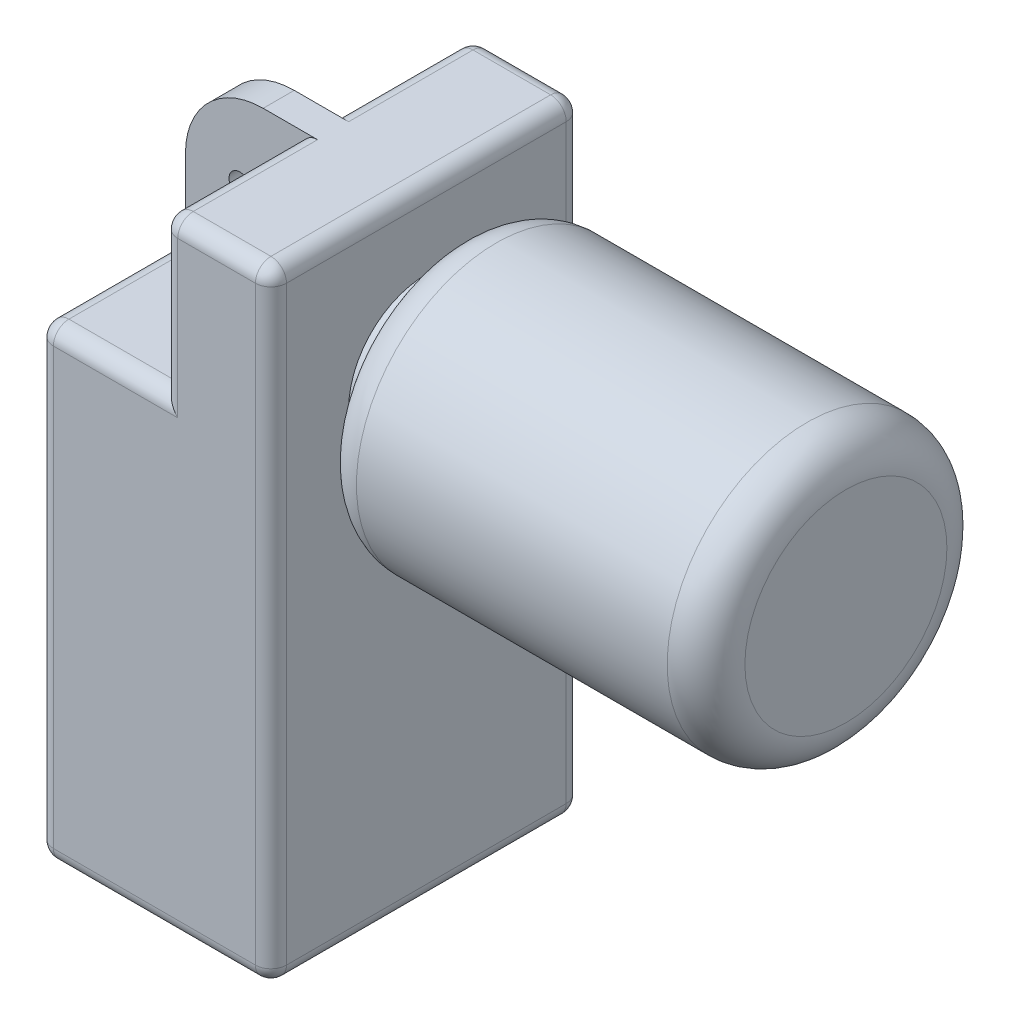
from build123d import *

# Parameters (mm, degrees)
SKETCH_1_R          = 7
EXTRUDE_1_DEPTH     = 20
SKETCH_2_W          = 150
SKETCH_2_H          = 200
EXTRUDE_2_DEPTH     = 300
SKETCH_3_W          = 70
SKETCH_3_H          = 200
EXTRUDE_3_DEPTH     = 100
SKETCH_4_R          = 50
EXTRUDE_4_DEPTH     = 20
SKETCH_5_R          = 90
EXTRUDE_5_DEPTH     = 250
FILLET_1_R          = 25
FILLET_2_R          = 10
SKETCH_6_R          = 25.5
CUT_EXTRUDE_1_DEPTH = 100


with BuildPart() as part:
    # 草图1 → 凸台-拉伸1 (new body)
    with BuildSketch(Plane.XY):
        with BuildLine():
            Line((-35, 0), (-35, -50))
            Line((-35, -50), (40, -50))
            Line((40, -50), (40, 50))
            Line((40, 50), (15, 50))
            ThreePointArc((15, 50), (-20.355339059, 35.355339059), (-35, 0))
        make_face()
        Circle(SKETCH_1_R, mode=Mode.SUBTRACT)
    extrude(amount=EXTRUDE_1_DEPTH)

    # 草图2 → 凸台-拉伸2 (add)
    with BuildSketch(Plane(origin=(0, -50, 0), x_dir=(-1, 0, 0), z_dir=(0, -1, 0))):
        with Locations((-35, -10)):
            Rectangle(SKETCH_2_W, SKETCH_2_H)
    extrude(amount=EXTRUDE_2_DEPTH)

    # 草图3 → 凸台-拉伸3 (add)
    with BuildSketch(Plane(origin=(0, -50, 0), x_dir=(1, 0, 0), z_dir=(0, 1, 0))):
        with Locations((75, -10)):
            Rectangle(SKETCH_3_W, SKETCH_3_H)
    extrude(amount=EXTRUDE_3_DEPTH)

    # 草图4 → 凸台-拉伸4 (add)
    with BuildSketch(Plane(origin=(110, 0, 0), x_dir=(0, 0, -1), z_dir=(1, 0, 0))):
        with Locations(Location((-10, -50, 0), (0, 0, 180))):
            Circle(SKETCH_4_R)
    extrude(amount=EXTRUDE_4_DEPTH)

    # 草图5 → 凸台-拉伸5 (add)
    with BuildSketch(Plane(origin=(130, 0, 0), x_dir=(0, 0, -1), z_dir=(1, 0, 0))):
        with Locations((-10, -50)):
            Circle(SKETCH_5_R)
    extrude(amount=EXTRUDE_5_DEPTH)

    # 圆角1
    fillet_1_edges = [part.edges().sort_by_distance(p)[0] for p in [
        (130, -50, 100),
        (380, -50, 100),
    ]]
    fillet(fillet_1_edges, radius=FILLET_1_R)

    # 圆角2
    # the kernel refuses this fillet: 10 mm, written as the material it takes off along each edge
    with BuildSketch(Plane(origin=(50, 40, 100), x_dir=(-1, 0, 0), z_dir=(0, 1, 0))) as fillet_2_piece_1_section:
        Polygon((0, 0), (FILLET_2_R, 0), (FILLET_2_R, FILLET_2_R), (0, FILLET_2_R), align=None)
    fillet_2_piece_1 = extrude(amount=FILLET_2_R, mode=Mode.PRIVATE)
    fillet_2_piece_1 = fillet_2_piece_1 - Plane(origin=(50, 40, 100), x_dir=(0.7071067811865475, 0, -0.7071067811865477), z_dir=(0, 1, 0)) * Sphere(FILLET_2_R, mode=Mode.PRIVATE)
    add(fillet_2_piece_1, mode=Mode.SUBTRACT)
    with BuildSketch(Plane(origin=(100, 40, 100), x_dir=(1, 0, 0), z_dir=(0, 1, 0))) as fillet_2_piece_2_section:
        Polygon((0, 0), (FILLET_2_R, 0), (FILLET_2_R, -FILLET_2_R), (0, -FILLET_2_R), align=None)
    fillet_2_piece_2 = extrude(amount=FILLET_2_R, mode=Mode.PRIVATE)
    fillet_2_piece_2 = fillet_2_piece_2 - Plane(origin=(100, 40, 100), x_dir=(-0.7071067811865475, 0, -0.7071067811865476), z_dir=(0, 1, 0)) * Sphere(FILLET_2_R, mode=Mode.PRIVATE)
    add(fillet_2_piece_2, mode=Mode.SUBTRACT)
    with BuildSketch(Plane(origin=(-30, -60, -80), x_dir=(-1, 0, 0), z_dir=(0, 0, -1))) as fillet_2_piece_3_section:
        Polygon((0, 0), (FILLET_2_R, 0), (FILLET_2_R, FILLET_2_R), (0, FILLET_2_R), align=None)
    fillet_2_piece_3 = extrude(amount=FILLET_2_R, mode=Mode.PRIVATE)
    fillet_2_piece_3 = fillet_2_piece_3 - Plane(origin=(-30, -60, -80), x_dir=(0.7071067811865475, -0.7071067811865475, 0), z_dir=(0, 0, -1)) * Sphere(FILLET_2_R, mode=Mode.PRIVATE)
    add(fillet_2_piece_3, mode=Mode.SUBTRACT)
    with BuildSketch(Plane(origin=(-30, -60, 100), x_dir=(0, 1, 0), z_dir=(-1, 0, 0))) as fillet_2_piece_4_section:
        Polygon((0, 0), (FILLET_2_R, 0), (FILLET_2_R, -FILLET_2_R), (0, -FILLET_2_R), align=None)
    fillet_2_piece_4 = extrude(amount=FILLET_2_R, mode=Mode.PRIVATE)
    fillet_2_piece_4 = fillet_2_piece_4 - Plane(origin=(-30, -60, 100), x_dir=(0, -0.7071067811865475, -0.7071067811865475), z_dir=(-1, 0, 0)) * Sphere(FILLET_2_R, mode=Mode.PRIVATE)
    add(fillet_2_piece_4, mode=Mode.SUBTRACT)
    with BuildSketch(Plane(origin=(-30, -340, 100), x_dir=(-1, 0, 0), z_dir=(0, -1, 0))) as fillet_2_piece_5_section:
        Polygon((0, 0), (FILLET_2_R, 0), (FILLET_2_R, -FILLET_2_R), (0, -FILLET_2_R), align=None)
    fillet_2_piece_5 = extrude(amount=FILLET_2_R, mode=Mode.PRIVATE)
    fillet_2_piece_5 = fillet_2_piece_5 - Plane(origin=(-30, -340, 100), x_dir=(0.7071067811865475, 0, -0.7071067811865475), z_dir=(0, -1, 0)) * Sphere(FILLET_2_R, mode=Mode.PRIVATE)
    add(fillet_2_piece_5, mode=Mode.SUBTRACT)
    with BuildSketch(Plane(origin=(100, -340, 100), x_dir=(1, 0, 0), z_dir=(0, -1, 0))) as fillet_2_piece_6_section:
        Polygon((0, 0), (FILLET_2_R, 0), (FILLET_2_R, FILLET_2_R), (0, FILLET_2_R), align=None)
    fillet_2_piece_6 = extrude(amount=FILLET_2_R, mode=Mode.PRIVATE)
    fillet_2_piece_6 = fillet_2_piece_6 - Plane(origin=(100, -340, 100), x_dir=(-0.7071067811865475, 0, -0.7071067811865476), z_dir=(0, -1, 0)) * Sphere(FILLET_2_R, mode=Mode.PRIVATE)
    add(fillet_2_piece_6, mode=Mode.SUBTRACT)
    with BuildSketch(Plane(origin=(100, -340, -80), x_dir=(0, 0, -1), z_dir=(0, -1, 0))) as fillet_2_piece_7_section:
        Polygon((0, 0), (FILLET_2_R, 0), (FILLET_2_R, FILLET_2_R), (0, FILLET_2_R), align=None)
    fillet_2_piece_7 = extrude(amount=FILLET_2_R, mode=Mode.PRIVATE)
    fillet_2_piece_7 = fillet_2_piece_7 - Plane(origin=(100, -340, -80), x_dir=(-0.7071067811865475, 0, 0.7071067811865475), z_dir=(0, -1, 0)) * Sphere(FILLET_2_R, mode=Mode.PRIVATE)
    add(fillet_2_piece_7, mode=Mode.SUBTRACT)
    with BuildSketch(Plane(origin=(-30, -340, -80), x_dir=(0, 0, -1), z_dir=(0, -1, 0))) as fillet_2_piece_8_section:
        Polygon((0, 0), (FILLET_2_R, 0), (FILLET_2_R, -FILLET_2_R), (0, -FILLET_2_R), align=None)
    fillet_2_piece_8 = extrude(amount=FILLET_2_R, mode=Mode.PRIVATE)
    fillet_2_piece_8 = fillet_2_piece_8 - Plane(origin=(-30, -340, -80), x_dir=(0.7071067811865475, 0, 0.7071067811865476), z_dir=(0, -1, 0)) * Sphere(FILLET_2_R, mode=Mode.PRIVATE)
    add(fillet_2_piece_8, mode=Mode.SUBTRACT)
    with BuildSketch(Plane(origin=(50, 40, -80), x_dir=(0, 0, -1), z_dir=(0, 1, 0))) as fillet_2_piece_9_section:
        Polygon((0, 0), (FILLET_2_R, 0), (FILLET_2_R, FILLET_2_R), (0, FILLET_2_R), align=None)
    fillet_2_piece_9 = extrude(amount=FILLET_2_R, mode=Mode.PRIVATE)
    fillet_2_piece_9 = fillet_2_piece_9 - Plane(origin=(50, 40, -80), x_dir=(0.7071067811865475, 0, 0.7071067811865475), z_dir=(0, 1, 0)) * Sphere(FILLET_2_R, mode=Mode.PRIVATE)
    add(fillet_2_piece_9, mode=Mode.SUBTRACT)
    with BuildSketch(Plane(origin=(100, 40, -80), x_dir=(0, 0, -1), z_dir=(0, 1, 0))) as fillet_2_piece_10_section:
        Polygon((0, 0), (FILLET_2_R, 0), (FILLET_2_R, -FILLET_2_R), (0, -FILLET_2_R), align=None)
    fillet_2_piece_10 = extrude(amount=FILLET_2_R, mode=Mode.PRIVATE)
    fillet_2_piece_10 = fillet_2_piece_10 - Plane(origin=(100, 40, -80), x_dir=(-0.7071067811865475, 0, 0.7071067811865475), z_dir=(0, 1, 0)) * Sphere(FILLET_2_R, mode=Mode.PRIVATE)
    add(fillet_2_piece_10, mode=Mode.SUBTRACT)
    with BuildSketch(Plane(origin=(50, 50, 110), x_dir=(0, -1, 0), z_dir=(1, 0, 0))) as fillet_2_piece_11:
        with BuildLine():
            CenterArc((FILLET_2_R, FILLET_2_R), FILLET_2_R, 180, 90)
            Line((0, FILLET_2_R), (0, 0))
            Line((0, 0), (FILLET_2_R, 0))
        make_face()
    extrude(amount=50, mode=Mode.SUBTRACT)
    with BuildSketch(Plane(origin=(40, -50, 110), x_dir=(1, 0, 0), z_dir=(0, 1, 0))) as fillet_2_piece_12:
        with BuildLine():
            CenterArc((FILLET_2_R, FILLET_2_R), FILLET_2_R, 180, 90)
            Line((0, FILLET_2_R), (0, 0))
            Line((0, 0), (FILLET_2_R, 0))
        make_face()
    extrude(amount=90, mode=Mode.SUBTRACT)
    with BuildSketch(Plane(origin=(-40, -50, -80), x_dir=(0, -1, 0), z_dir=(0, 0, 1))) as fillet_2_piece_13_section:
        with BuildLine():
            CenterArc((FILLET_2_R, FILLET_2_R), FILLET_2_R, 180, 90)
            Line((0, FILLET_2_R), (0, 0))
            Line((0, 0), (FILLET_2_R, 0))
        make_face()
    fillet_2_piece_13 = extrude(amount=180, mode=Mode.PRIVATE)
    fillet_2_piece_13 = split(fillet_2_piece_13, bisect_by=Plane(origin=(-38.356082357, -52.5512006, 0), z_dir=(0, 0, -1)), keep=Keep.TOP, mode=Mode.PRIVATE)
    fillet_2_piece_13 = split(fillet_2_piece_13, bisect_by=Plane(origin=(-35, -52.5512006, -40), z_dir=(-1, 0, 0)), keep=Keep.TOP, mode=Mode.PRIVATE)
    add(fillet_2_piece_13, mode=Mode.SUBTRACT)
    with BuildSketch(Plane(origin=(-40, -50, -80), x_dir=(0, -1, 0), z_dir=(0, 0, 1))) as fillet_2_piece_14_section:
        with BuildLine():
            CenterArc((FILLET_2_R, FILLET_2_R), FILLET_2_R, 180, 90)
            Line((0, FILLET_2_R), (0, 0))
            Line((0, 0), (FILLET_2_R, 0))
        make_face()
    fillet_2_piece_14 = extrude(amount=180, mode=Mode.PRIVATE)
    fillet_2_piece_14 = split(fillet_2_piece_14, bisect_by=Plane(origin=(-33.367492155, -50.240083817, 0), z_dir=(0, 0, -1)), keep=Keep.TOP, mode=Mode.PRIVATE)
    fillet_2_piece_14 = split(fillet_2_piece_14, bisect_by=Plane(origin=(-35, -50.240083817, -40), z_dir=(1, 0, 0)), keep=Keep.TOP, mode=Mode.PRIVATE)
    add(fillet_2_piece_14, mode=Mode.SUBTRACT)
    with BuildSketch(Plane(origin=(-40, -50, -80), x_dir=(0, -1, 0), z_dir=(0, 0, 1))) as fillet_2_piece_15_section:
        with BuildLine():
            CenterArc((FILLET_2_R, FILLET_2_R), FILLET_2_R, 180, 90)
            Line((0, FILLET_2_R), (0, 0))
            Line((0, 0), (FILLET_2_R, 0))
        make_face()
    fillet_2_piece_15 = extrude(amount=180, mode=Mode.PRIVATE)
    fillet_2_piece_15 = split(fillet_2_piece_15, bisect_by=Plane(origin=(-38.356082357, -52.5512006, 0), z_dir=(0, 0, 1)), keep=Keep.TOP, mode=Mode.PRIVATE)
    fillet_2_piece_15 = split(fillet_2_piece_15, bisect_by=Plane(origin=(-35, -52.5512006, 10), z_dir=(-1, 0, 0)), keep=Keep.TOP, mode=Mode.PRIVATE)
    fillet_2_piece_15 = split(fillet_2_piece_15, bisect_by=Plane(origin=(-38.356082357, -52.5512006, 20), z_dir=(0, 0, -1)), keep=Keep.TOP, mode=Mode.PRIVATE)
    add(fillet_2_piece_15, mode=Mode.SUBTRACT)
    with BuildSketch(Plane(origin=(-40, -50, -80), x_dir=(0, -1, 0), z_dir=(0, 0, 1))) as fillet_2_piece_16_section:
        with BuildLine():
            CenterArc((FILLET_2_R, FILLET_2_R), FILLET_2_R, 180, 90)
            Line((0, FILLET_2_R), (0, 0))
            Line((0, 0), (FILLET_2_R, 0))
        make_face()
    fillet_2_piece_16 = extrude(amount=180, mode=Mode.PRIVATE)
    fillet_2_piece_16 = split(fillet_2_piece_16, bisect_by=Plane(origin=(-35, -52.5512006, 60), z_dir=(-1, 0, 0)), keep=Keep.TOP, mode=Mode.PRIVATE)
    fillet_2_piece_16 = split(fillet_2_piece_16, bisect_by=Plane(origin=(-38.356082357, -52.5512006, 20), z_dir=(0, 0, 1)), keep=Keep.TOP, mode=Mode.PRIVATE)
    add(fillet_2_piece_16, mode=Mode.SUBTRACT)
    with BuildSketch(Plane(origin=(-40, -50, -80), x_dir=(0, -1, 0), z_dir=(0, 0, 1))) as fillet_2_piece_17_section:
        with BuildLine():
            CenterArc((FILLET_2_R, FILLET_2_R), FILLET_2_R, 180, 90)
            Line((0, FILLET_2_R), (0, 0))
            Line((0, 0), (FILLET_2_R, 0))
        make_face()
    fillet_2_piece_17 = extrude(amount=180, mode=Mode.PRIVATE)
    fillet_2_piece_17 = split(fillet_2_piece_17, bisect_by=Plane(origin=(-35, -50.240083817, 60), z_dir=(1, 0, 0)), keep=Keep.TOP, mode=Mode.PRIVATE)
    fillet_2_piece_17 = split(fillet_2_piece_17, bisect_by=Plane(origin=(-33.367492155, -50.240083817, 20), z_dir=(0, 0, 1)), keep=Keep.TOP, mode=Mode.PRIVATE)
    add(fillet_2_piece_17, mode=Mode.SUBTRACT)
    with BuildSketch(Plane(origin=(-40, -60, 110), x_dir=(1, 0, 0), z_dir=(0, -1, 0))) as fillet_2_piece_18:
        with BuildLine():
            CenterArc((FILLET_2_R, -FILLET_2_R), FILLET_2_R, 90, 90)
            Line((0, -FILLET_2_R), (0, 0))
            Line((0, 0), (FILLET_2_R, 0))
        make_face()
    extrude(amount=280, mode=Mode.SUBTRACT)
    with BuildSketch(Plane(origin=(110, -340, 110), x_dir=(0, 0, -1), z_dir=(0, 1, 0))) as fillet_2_piece_19:
        with BuildLine():
            CenterArc((FILLET_2_R, FILLET_2_R), FILLET_2_R, 180, 90)
            Line((0, FILLET_2_R), (0, 0))
            Line((0, 0), (FILLET_2_R, 0))
        make_face()
    extrude(amount=380, mode=Mode.SUBTRACT)
    with BuildSketch(Plane(origin=(110, -350, 100), x_dir=(0, 1, 0), z_dir=(0, 0, -1))) as fillet_2_piece_20:
        with BuildLine():
            CenterArc((FILLET_2_R, -FILLET_2_R), FILLET_2_R, 90, 90)
            Line((0, -FILLET_2_R), (0, 0))
            Line((0, 0), (FILLET_2_R, 0))
        make_face()
    extrude(amount=180, mode=Mode.SUBTRACT)
    with BuildSketch(Plane(origin=(-30, -350, 110), x_dir=(0, 1, 0), z_dir=(1, 0, 0))) as fillet_2_piece_21:
        with BuildLine():
            CenterArc((FILLET_2_R, -FILLET_2_R), FILLET_2_R, 90, 90)
            Line((0, -FILLET_2_R), (0, 0))
            Line((0, 0), (FILLET_2_R, 0))
        make_face()
    extrude(amount=130, mode=Mode.SUBTRACT)
    with BuildSketch(Plane(origin=(-40, -350, -80), x_dir=(1, 0, 0), z_dir=(0, 0, 1)), Plane(origin=(110, 50, 100), x_dir=(0, -1, 0), z_dir=(0, 0, -1))) as fillet_2_piece_22:
        with BuildLine():
            CenterArc((FILLET_2_R, FILLET_2_R), FILLET_2_R, 180, 90)
            Line((0, FILLET_2_R), (0, 0))
            Line((0, 0), (FILLET_2_R, 0))
        make_face()
    extrude(amount=180, mode=Mode.SUBTRACT)
    with BuildSketch(Plane(origin=(40, -50, -90), x_dir=(0, -1, 0), z_dir=(-1, 0, 0)), Plane(origin=(-30, -50, 110), x_dir=(0, -1, 0), z_dir=(1, 0, 0))) as fillet_2_piece_23:
        with BuildLine():
            CenterArc((FILLET_2_R, FILLET_2_R), FILLET_2_R, 180, 90)
            Line((0, FILLET_2_R), (0, 0))
            Line((0, 0), (FILLET_2_R, 0))
        make_face()
    extrude(amount=70, mode=Mode.SUBTRACT)
    with BuildSketch(Plane(origin=(40, -50, -90), x_dir=(1, 0, 0), z_dir=(0, 1, 0))) as fillet_2_piece_24:
        with BuildLine():
            CenterArc((FILLET_2_R, -FILLET_2_R), FILLET_2_R, 90, 90)
            Line((0, -FILLET_2_R), (0, 0))
            Line((0, 0), (FILLET_2_R, 0))
        make_face()
    extrude(amount=90, mode=Mode.SUBTRACT)
    with BuildSketch(Plane(origin=(100, 50, -90), x_dir=(0, 0, 1), z_dir=(-1, 0, 0))) as fillet_2_piece_25:
        with BuildLine():
            CenterArc((FILLET_2_R, -FILLET_2_R), FILLET_2_R, 90, 90)
            Line((0, -FILLET_2_R), (0, 0))
            Line((0, 0), (FILLET_2_R, 0))
        make_face()
    extrude(amount=50, mode=Mode.SUBTRACT)
    with BuildSketch(Plane(origin=(-40, -60, -90), x_dir=(1, 0, 0), z_dir=(0, -1, 0))) as fillet_2_piece_26:
        with BuildLine():
            CenterArc((FILLET_2_R, FILLET_2_R), FILLET_2_R, 180, 90)
            Line((0, FILLET_2_R), (0, 0))
            Line((0, 0), (FILLET_2_R, 0))
        make_face()
    extrude(amount=280, mode=Mode.SUBTRACT)
    with BuildSketch(Plane(origin=(100, -350, -90), x_dir=(0, 0, 1), z_dir=(-1, 0, 0))) as fillet_2_piece_27:
        with BuildLine():
            CenterArc((FILLET_2_R, FILLET_2_R), FILLET_2_R, 180, 90)
            Line((0, FILLET_2_R), (0, 0))
            Line((0, 0), (FILLET_2_R, 0))
        make_face()
    extrude(amount=130, mode=Mode.SUBTRACT)
    with BuildSketch(Plane(origin=(110, -340, -90), x_dir=(0, 0, 1), z_dir=(0, 1, 0))) as fillet_2_piece_28:
        with BuildLine():
            CenterArc((FILLET_2_R, -FILLET_2_R), FILLET_2_R, 90, 90)
            Line((0, -FILLET_2_R), (0, 0))
            Line((0, 0), (FILLET_2_R, 0))
        make_face()
    extrude(amount=380, mode=Mode.SUBTRACT)
    with BuildSketch(Plane(origin=(40, 50, -80), x_dir=(1, 0, 0), z_dir=(0, 0, 1)), Plane(origin=(40, 50, 20), x_dir=(1, 0, 0), z_dir=(0, 0, 1))) as fillet_2_piece_29:
        with BuildLine():
            CenterArc((FILLET_2_R, -FILLET_2_R), FILLET_2_R, 90, 90)
            Line((0, -FILLET_2_R), (0, 0))
            Line((0, 0), (FILLET_2_R, 0))
        make_face()
    extrude(amount=80, mode=Mode.SUBTRACT)
    with BuildSketch(Plane(origin=(40, 50, -80), x_dir=(1, 0, 0), z_dir=(0, 0, 1))) as fillet_2_piece_30_section:
        with BuildLine():
            CenterArc((FILLET_2_R, -FILLET_2_R), FILLET_2_R, 90, 90)
            Line((0, -FILLET_2_R), (0, 0))
            Line((0, 0), (FILLET_2_R, 0))
        make_face()
    fillet_2_piece_30 = extrude(amount=105, mode=Mode.PRIVATE)
    fillet_2_piece_30 = split(fillet_2_piece_30, bisect_by=Plane(origin=(42.263951143, 47.736048857, 20), z_dir=(0, 0, 1)), keep=Keep.TOP, mode=Mode.PRIVATE)
    add(fillet_2_piece_30, mode=Mode.SUBTRACT)
    with BuildSketch(Plane(origin=(40, 50, -5), x_dir=(1, 0, 0), z_dir=(0, 0, 1))) as fillet_2_piece_31_section:
        with BuildLine():
            CenterArc((FILLET_2_R, -FILLET_2_R), FILLET_2_R, 90, 90)
            Line((0, -FILLET_2_R), (0, 0))
            Line((0, 0), (FILLET_2_R, 0))
        make_face()
    fillet_2_piece_31 = extrude(amount=105, mode=Mode.PRIVATE)
    fillet_2_piece_31 = split(fillet_2_piece_31, bisect_by=Plane(origin=(42.263951143, 47.736048857, 0), z_dir=(0, 0, -1)), keep=Keep.TOP, mode=Mode.PRIVATE)
    add(fillet_2_piece_31, mode=Mode.SUBTRACT)
    with BuildSketch(Plane(origin=(40, -75, 110), x_dir=(1, 0, 0), z_dir=(0, 1, 0))) as fillet_2_piece_32a_section:
        with BuildLine():
            CenterArc((FILLET_2_R, FILLET_2_R), FILLET_2_R, 180, 90)
            Line((0, FILLET_2_R), (0, 0))
            Line((0, 0), (FILLET_2_R, 0))
        make_face()
    fillet_2_piece_32a = extrude(amount=115, mode=Mode.PRIVATE)
    fillet_2_piece_32a = split(fillet_2_piece_32a, bisect_by=Plane(origin=(42.263951143, -50, 107.736048857), z_dir=(0, -1, 0)), keep=Keep.TOP, mode=Mode.PRIVATE)
    with BuildSketch(Plane(origin=(-30, -50, 110), x_dir=(0, -1, 0), z_dir=(1, 0, 0))) as fillet_2_piece_32b_section:
        with BuildLine():
            CenterArc((FILLET_2_R, FILLET_2_R), FILLET_2_R, 180, 90)
            Line((0, FILLET_2_R), (0, 0))
            Line((0, 0), (FILLET_2_R, 0))
        make_face()
    fillet_2_piece_32b = extrude(amount=95, mode=Mode.PRIVATE)
    fillet_2_piece_32b = split(fillet_2_piece_32b, bisect_by=Plane(origin=(40, -52.263951143, 107.736048857), z_dir=(1, 0, 0)), keep=Keep.TOP, mode=Mode.PRIVATE)
    fillet_2_piece_32 = fillet_2_piece_32a & fillet_2_piece_32b
    add(fillet_2_piece_32, mode=Mode.SUBTRACT)
    with BuildSketch(Plane(origin=(65, -50, -90), x_dir=(0, -1, 0), z_dir=(-1, 0, 0))) as fillet_2_piece_33a_section:
        with BuildLine():
            CenterArc((FILLET_2_R, FILLET_2_R), FILLET_2_R, 180, 90)
            Line((0, FILLET_2_R), (0, 0))
            Line((0, 0), (FILLET_2_R, 0))
        make_face()
    fillet_2_piece_33a = extrude(amount=95, mode=Mode.PRIVATE)
    fillet_2_piece_33a = split(fillet_2_piece_33a, bisect_by=Plane(origin=(40, -52.263951143, -87.736048857), z_dir=(1, 0, 0)), keep=Keep.TOP, mode=Mode.PRIVATE)
    with BuildSketch(Plane(origin=(40, -75, -90), x_dir=(1, 0, 0), z_dir=(0, 1, 0))) as fillet_2_piece_33b_section:
        with BuildLine():
            CenterArc((FILLET_2_R, -FILLET_2_R), FILLET_2_R, 90, 90)
            Line((0, -FILLET_2_R), (0, 0))
            Line((0, 0), (FILLET_2_R, 0))
        make_face()
    fillet_2_piece_33b = extrude(amount=115, mode=Mode.PRIVATE)
    fillet_2_piece_33b = split(fillet_2_piece_33b, bisect_by=Plane(origin=(42.263951143, -50, -87.736048857), z_dir=(0, -1, 0)), keep=Keep.TOP, mode=Mode.PRIVATE)
    fillet_2_piece_33 = fillet_2_piece_33a & fillet_2_piece_33b
    add(fillet_2_piece_33, mode=Mode.SUBTRACT)

    # 草图6 → 切除-拉伸1 (cut)
    with BuildSketch(Plane.ZY.offset(40)):
        with Locations((10, -224)):
            Circle(SKETCH_6_R)
    extrude(amount=-CUT_EXTRUDE_1_DEPTH, mode=Mode.SUBTRACT)


solid = part.part
